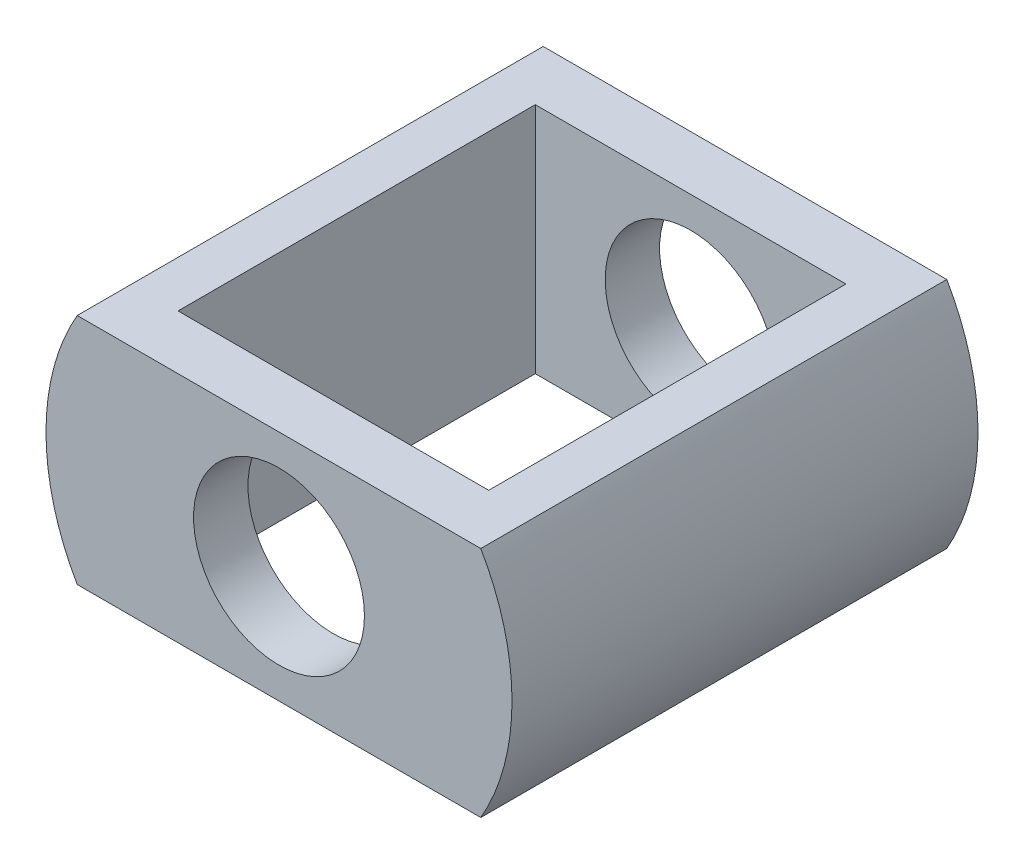
from build123d import *

# Parameters (mm, degrees)
CROQUIS1_R              = 11
SALIENTE_EXTRUIR1_DEPTH = 60
CROQUIS2_W              = 30
CROQUIS2_H              = 40
CORTAR_EXTRUIR1_DEPTH   = 23


with BuildPart() as part:
    # Croquis1 → Saliente-Extruir1 (new body)
    with BuildSketch(Plane(origin=(0, 0, 0), x_dir=(0, 1, 0), z_dir=(0, 0, 1))):
        with BuildLine():
            Line((-15, -25.980762114), (-15, 25.980762114))
            ThreePointArc((-15, 25.980762114), (0, 30), (15, 25.980762114))
            Line((15, 25.980762114), (15, -25.980762114))
            ThreePointArc((15, -25.980762114), (0, -30), (-15, -25.980762114))
        make_face()
        Circle(CROQUIS1_R, mode=Mode.SUBTRACT)
    extrude(amount=SALIENTE_EXTRUIR1_DEPTH)

    # Croquis2 → Cortar-Extruir1 (cut, symmetric)
    with BuildSketch(Plane(origin=(0, 0, 30), x_dir=(0, 1, 0), z_dir=(0, 0, 1))):
        Rectangle(CROQUIS2_W, CROQUIS2_H)
    extrude(amount=CORTAR_EXTRUIR1_DEPTH, both=True, mode=Mode.SUBTRACT)


solid = part.part
